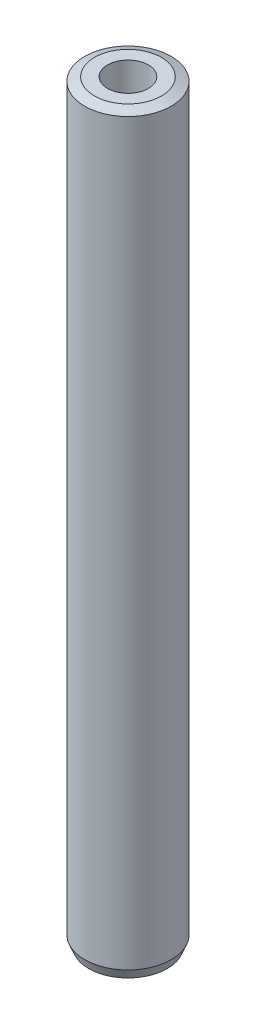
from build123d import *
from OCP.BRepFilletAPI import BRepFilletAPI_MakeChamfer

# Parameters (mm, degrees)
SKETCH1_R           = 12.5
BOSS_EXTRUDE1_DEPTH = 217.734931523
SKETCH2_R           = 5.903655993
CUT_EXTRUDE1_DEPTH  = 219.451368513
CHAMFER1_SIZE       = 1.15365969
CHAMFER1_SIZE2      = 2.818925883


with BuildPart() as part:
    # Sketch1 → Boss-Extrude1 (new body)
    with BuildSketch(Plane(origin=(0, 0, 0), x_dir=(1, 0, 0), z_dir=(0, 1, 0))):
        Circle(SKETCH1_R)
    extrude(amount=BOSS_EXTRUDE1_DEPTH)

    # Sketch2 → Cut-Extrude1 (cut, through all)
    with BuildSketch(Plane(origin=(0, 0, 0), x_dir=(1, 0, 0), z_dir=(0, 1, 0))):
        Circle(SKETCH2_R)
    extrude(amount=CUT_EXTRUDE1_DEPTH, mode=Mode.SUBTRACT)

    # Chamfer1: one chamfer whose edges measure the first distance from different faces: ONE call of the kernel's chamfer builder (chamfer() names one face for all edges)
    chamfer1_edges_1 = [part.edges().sort_by_distance(p)[0] for p in [
        (-12.5, 217.734931523, 0),
    ]]
    chamfer1_side_1 = [part.faces().sort_by_distance(p)[0] for p in [
        (-12.5, 108.867465761, 0),
    ]]
    chamfer1_edges_2 = [part.edges().sort_by_distance(p)[0] for p in [
        (-12.5, 0, 0),
    ]]
    chamfer1_side_2 = [part.faces().sort_by_distance(p)[0] for p in [
        (-12.146446609, 0, 0),
    ]]
    chamfer1 = BRepFilletAPI_MakeChamfer(part.part.solid().wrapped)
    for e in chamfer1_edges_1:
        chamfer1.Add(CHAMFER1_SIZE, CHAMFER1_SIZE2, e.wrapped, chamfer1_side_1[0].wrapped)  # the first distance lies on this face
    for e in chamfer1_edges_2:
        chamfer1.Add(CHAMFER1_SIZE, CHAMFER1_SIZE2, e.wrapped, chamfer1_side_2[0].wrapped)  # the first distance lies on this face
    add(Compound.cast(chamfer1.Shape()), mode=Mode.REPLACE)


solid = part.part
